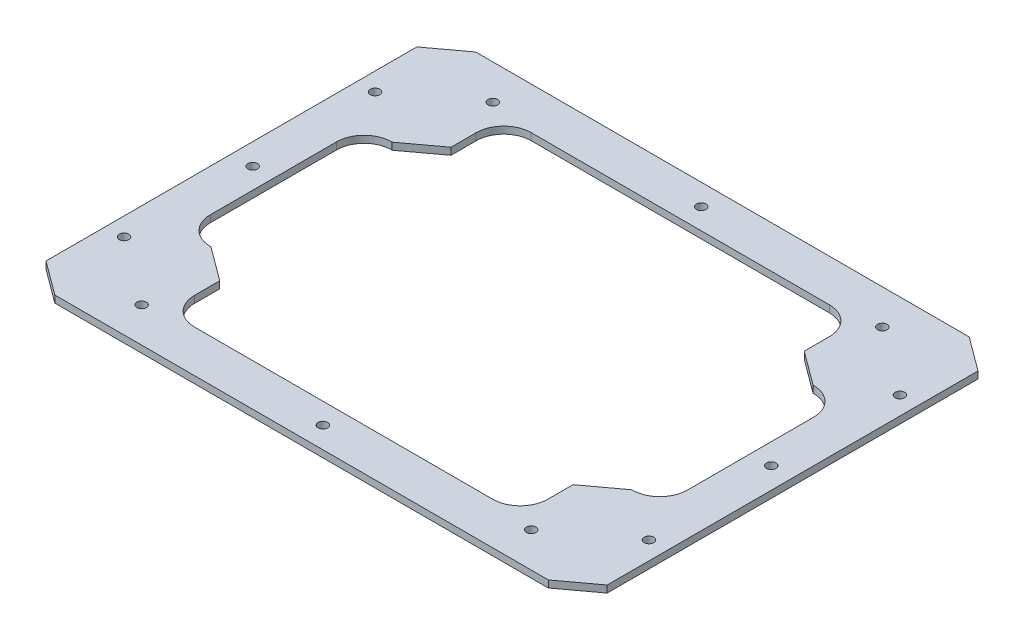
from build123d import *

# Parameters (mm, degrees)
BOSS_EXTRUDE1_DEPTH = 3.175
SKETCH2_R           = 2.159
CUT_EXTRUDE1_DEPTH  = 159.781746826


with BuildPart() as part:
    # Sketch1 → Boss-Extrude1 (new body)
    with BuildSketch(Plane(origin=(0, 0, 0), x_dir=(1, 0, 0), z_dir=(0, 1, 0))):
        Polygon((-111.686526805, 95.25), (-127, 83.918625912), (-127, -83.918625912), (-111.686526805, -95.25), (111.686526805, -95.25), (127, -83.918625912), (127, 83.918625912), (111.686526805, 95.25), align=None)
        with BuildLine():
            Line((-107.95, -28.564963508), (-107.95, 28.564963508))
            ThreePointArc((-107.95, 28.564963508), (-104.304650999, 37.365614506), (-95.504, 41.010963508))
            Line((-95.504, 41.010963508), (-95.25, 41.010963508))
            Line((-95.25, 41.010963508), (-79.936526805, 52.342337595))
            Line((-79.936526805, 52.342337595), (-79.936526805, 63.754))
            ThreePointArc((-79.936526805, 63.754), (-76.291177804, 72.554650999), (-67.490526805, 76.2))
            Line((-67.490526805, 76.2), (38.831798823, 76.2))
            Line((38.831798823, 76.2), (67.490526805, 76.2))
            ThreePointArc((67.490526805, 76.2), (76.291177804, 72.554650999), (79.936526805, 63.754))
            Line((79.936526805, 63.754), (79.936526805, 52.342337595))
            Line((79.936526805, 52.342337595), (95.25, 41.010963508))
            Line((95.25, 41.010963508), (95.504, 41.010963508))
            ThreePointArc((95.504, 41.010963508), (104.304650999, 37.365614506), (107.95, 28.564963508))
            Line((107.95, 28.564963508), (107.95, -28.564963508))
            ThreePointArc((107.95, -28.564963508), (104.304650999, -37.365614506), (95.504, -41.010963508))
            Line((95.504, -41.010963508), (95.25, -41.010963508))
            Line((95.25, -41.010963508), (79.936526805, -52.342337595))
            Line((79.936526805, -52.342337595), (79.936526805, -63.754))
            ThreePointArc((79.936526805, -63.754), (76.291177804, -72.554650999), (67.490526805, -76.2))
            Line((67.490526805, -76.2), (38.1, -76.2))
            Line((38.1, -76.2), (-67.490526805, -76.2))
            ThreePointArc((-67.490526805, -76.2), (-76.291177804, -72.554650999), (-79.936526805, -63.754))
            Line((-79.936526805, -63.754), (-79.936526805, -52.342337595))
            Line((-79.936526805, -52.342337595), (-95.25, -41.010963508))
            Line((-95.25, -41.010963508), (-95.504, -41.010963508))
            ThreePointArc((-95.504, -41.010963508), (-104.304650999, -37.365614506), (-107.95, -28.564963508))
        make_face(mode=Mode.SUBTRACT)
    extrude(amount=BOSS_EXTRUDE1_DEPTH)

    # Sketch2 → Cut-Extrude1 (cut, through all)
    with BuildSketch(Plane(origin=(0, 3.175, 0), x_dir=(1, 0, 0), z_dir=(0, 1, 0))):
        with Locations((-88.154790208, 79.461855841)):
            Circle(SKETCH2_R)
        with Locations((88.154790208, 79.461855841)):
            Circle(SKETCH2_R)
        with Locations((88.154790208, -79.461855841)):
            Circle(SKETCH2_R)
        with Locations((-88.154790208, -79.461855841)):
            Circle(SKETCH2_R)
        with Locations((-118.781736597, 56.799107666)):
            Circle(SKETCH2_R)
        with Locations((118.781736597, 56.799107666)):
            Circle(SKETCH2_R)
        with Locations((-118.781736597, -56.799107666)):
            Circle(SKETCH2_R)
        with Locations((118.781736597, -56.799107666)):
            Circle(SKETCH2_R)
        with Locations((0, -85.598)):
            Circle(SKETCH2_R)
        with Locations((0, 85.598)):
            Circle(SKETCH2_R)
        with Locations((-117.348, -0.020516524)):
            Circle(SKETCH2_R)
        with Locations((117.348, -0.020516524)):
            Circle(SKETCH2_R)
    extrude(amount=-CUT_EXTRUDE1_DEPTH, mode=Mode.SUBTRACT)


solid = part.part
